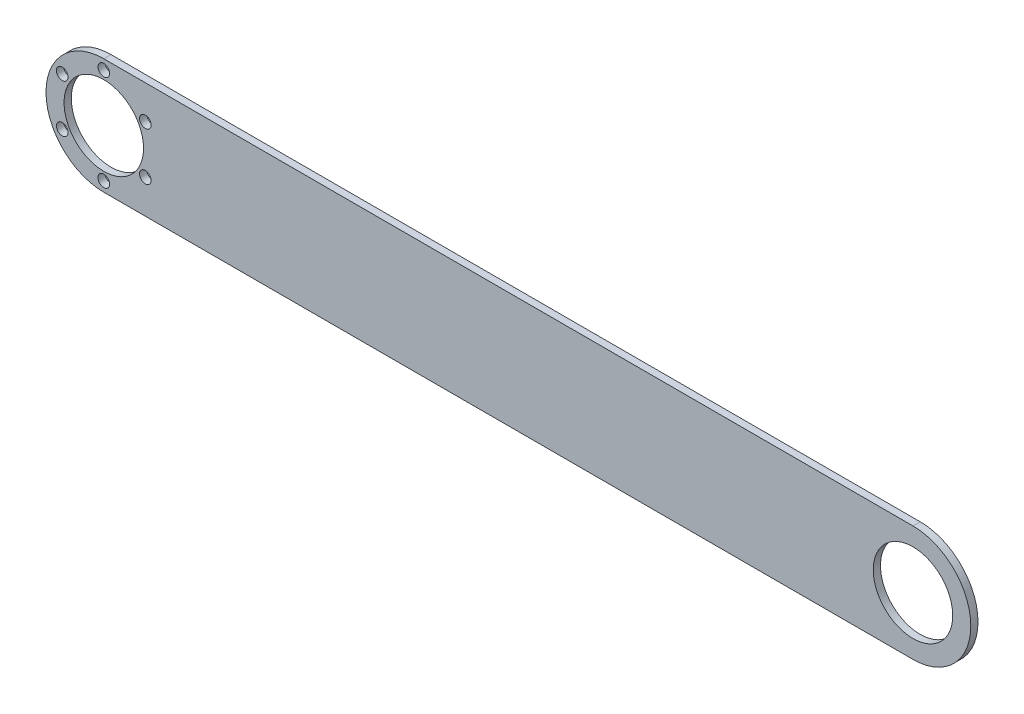
from build123d import *

# Parameters (mm, degrees)
BOSS_EXTRUDE1_DEPTH    = 3.175
SKETCH2_R              = 17.4625
CUT_EXTRUDE1_DEPTH     = 385.384860036
F_10_CLEARANCE_HOLE1_D = 5.1054


with BuildPart() as part:
    # Sketch1 → Boss-Extrude1 (new body)
    with BuildSketch(Plane.XY):
        with BuildLine():
            Line((0, 0), (355.6, 0))
            ThreePointArc((355.6, 0), (381, 25.4), (355.6, 50.8))
            Line((355.6, 50.8), (0, 50.8))
            ThreePointArc((0, 50.8), (-25.4, 25.4), (0, 0))
        make_face()
    extrude(amount=BOSS_EXTRUDE1_DEPTH)

    # Sketch2 → Cut-Extrude1 (cut, through all)
    with BuildSketch(Plane.XY.offset(3.175)):
        with Locations((0, 25.4)):
            Circle(SKETCH2_R)
        with Locations((355.6, 25.4)):
            Circle(SKETCH2_R)
    extrude(amount=-CUT_EXTRUDE1_DEPTH, mode=Mode.SUBTRACT)

    # #10 Clearance Hole1 (through all)
    with Locations(Plane(origin=(18.257547563, 35.941, 3.175), x_dir=(1, 0, 0), z_dir=(0, 0, 1))):
        with Locations((0, 0), (0, -21.082), (-18.257547563, -31.623), (-36.515095126, -21.082), (-36.515095126, 0), (-18.257547563, 10.541)):
            Hole(F_10_CLEARANCE_HOLE1_D / 2)


solid = part.part
